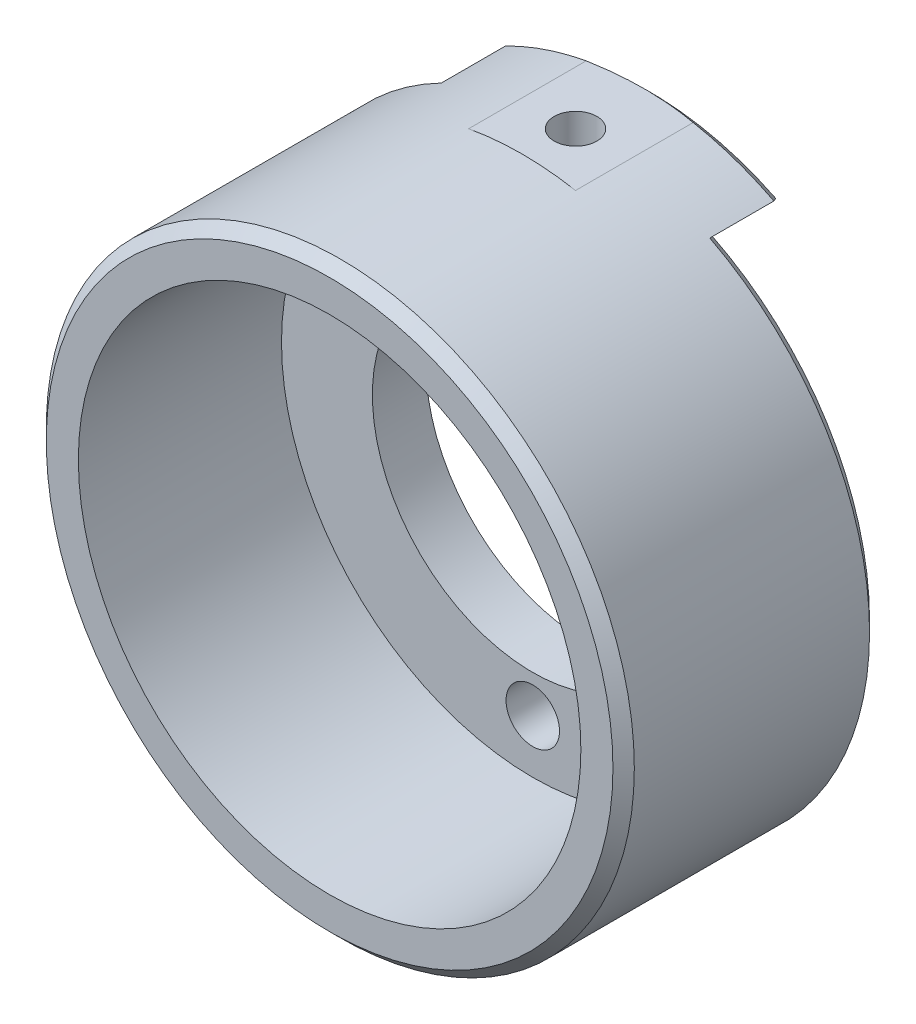
from build123d import *
from build123d.topology import SkipClean

# Parameters (mm, degrees)
SKETCH1_W               = 8.5
SKETCH1_H               = 5
SKETCH2_R               = 3.5
SKETCH2_R_2             = 2.5
BOSS_EXTRUDE1_DEPTH     = 6
CHAMFER1_SIZE           = 1
SKETCH4_W               = 10
SKETCH4_H               = 12
SKETCH4_R               = 2
CUT_EXTRUDE1_DEPTH      = 2.958365434
CUT_EXTRUDE2_DEPTH      = 7.958365434
CUT_EXTRUDE8_DEPTH      = 5
CUT_EXTRUDE8_DEPTH_BACK = 5
SKETCH8_R               = 2
SKETCH2_3_R             = 2.5
CUT_EXTRUDE9_DEPTH      = 46.700109409


with BuildPart() as part:
    # Sketch1 → Revolve1 (revolve)
    with BuildSketch(Plane(origin=(0, 0, 0), x_dir=(1, 0, 0), z_dir=(0, 1, 0)), mode=Mode.PRIVATE) as revolve1_sk:
        with Locations((-19.25, 21.5)):
            Rectangle(SKETCH1_W, SKETCH1_H)
        Polygon((-23.5, 19), (-23.5, 24), (-27.5, 24), (-27.5, 0), (-23.5, 0), align=None)
    revolve(revolve1_sk.sketch.rotate(Axis((0, 0, 8.695652174), (0, 0, -1)), 180), axis=Axis((0, 0, 8.695652174), (0, 0, -1)))

    # Sketch2 → Boss-Extrude1 (add)
    # profile 1 of 4: a face of its own
    with BuildSketch(Plane(origin=(0, 0, -24), x_dir=(-1, 0, 0), z_dir=(0, 0, -1))):
        with BuildLine():
            ThreePointArc((12.555578353, 24.466455653), (0, 27.5), (-12.555578353, 24.466455653))
            Line((-12.555578353, 24.466455653), (-2.249756634, 15.818844449))
            ThreePointArc((-2.249756634, 15.818844449), (-1.479163916, 21.672077255), (3.5, 18.5))
            ThreePointArc((3.5, 18.5), (3.172077255, 17.020836084), (2.249756634, 15.818844449))
            Line((2.249756634, 15.818844449), (12.555578353, 24.466455653))
        make_face()
    # profile 2 of 4: a face of its own
    with BuildSketch(Plane(origin=(0, 0, -24), x_dir=(-1, 0, 0), z_dir=(0, 0, -1))):
        with Locations((0, 18.5)):
            Circle(SKETCH2_R)
        with Locations((0, 18.5)):
            Circle(SKETCH2_R_2, mode=Mode.SUBTRACT)
    # profile 3 of 4: a face of its own
    with BuildSketch(Plane(origin=(0, 0, -24), x_dir=(-1, 0, 0), z_dir=(0, 0, -1))):
        with Locations((0, -18.5)):
            Circle(SKETCH2_R)
        with Locations((0, -18.5)):
            Circle(SKETCH2_R_2, mode=Mode.SUBTRACT)
    # profile 4 of 4: a face of its own
    with BuildSketch(Plane(origin=(0, 0, -24), x_dir=(-1, 0, 0), z_dir=(0, 0, -1))):
        with BuildLine():
            ThreePointArc((3.5, -18.5), (-1.479163916, -21.672077255), (-2.249756634, -15.818844449))
            Line((-2.249756634, -15.818844449), (-12.555578353, -24.466455653))
            ThreePointArc((-12.555578353, -24.466455653), (0, -27.5), (12.555578353, -24.466455653))
            Line((12.555578353, -24.466455653), (2.249756634, -15.818844449))
            ThreePointArc((2.249756634, -15.818844449), (3.172077255, -17.020836084), (3.5, -18.5))
        make_face()
    extrude(amount=BOSS_EXTRUDE1_DEPTH)

    # Chamfer1
    # the kernel refuses this chamfer: 1 mm, written as the material it takes off along each edge
    with BuildSketch(Plane(origin=(0, 0, 0), x_dir=(1, 0, 0), z_dir=(0, 1, 0))) as chamfer1_piece_1:
        Polygon((27.5, CHAMFER1_SIZE), (27.5 - CHAMFER1_SIZE, 0), (27.5, 0), align=None)
    revolve(axis=Axis((0, 0, 0), (0, 0, -1)), mode=Mode.SUBTRACT)
    with BuildSketch(Plane(origin=(0, 0, -24), x_dir=(-0.37142479481354274, -0.9284630427743032, 0), z_dir=(0.9284630427743032, -0.37142479481354274, 0))) as chamfer1_piece_2_section:
        Polygon((27.5 - CHAMFER1_SIZE, 0), (27.5, -CHAMFER1_SIZE), (27.5, 0), align=None)
    chamfer1_piece_2 = revolve(axis=Axis((0, 0, -24), (0, 0, -1)), revolution_arc=136.392970134, mode=Mode.PRIVATE)
    chamfer1_piece_2 = split(chamfer1_piece_2, bisect_by=Plane(origin=(-8.997837151, -21.481156322, -23.522667498), z_dir=(-0.6427876096865377, 0.7660444431189795, 0)), keep=Keep.TOP, mode=Mode.PRIVATE)
    chamfer1_piece_2 = split(chamfer1_piece_2, bisect_by=Plane(origin=(-8.997837151, 21.481156322, -23.522667498), z_dir=(-0.6427876096865377, -0.7660444431189795, 0)), keep=Keep.TOP, mode=Mode.PRIVATE)
    add(chamfer1_piece_2, mode=Mode.SUBTRACT)
    with BuildSketch(Plane(origin=(0, 0, -30), x_dir=(-0.5376618435911517, 0.8431605671200261, 0), z_dir=(-0.8431605671200261, -0.5376618435911517, 0))) as chamfer1_piece_3:
        Polygon((27.5 - CHAMFER1_SIZE, 0), (27.5, -CHAMFER1_SIZE), (27.5, 0), align=None)
    revolve(axis=Axis((0, 0, -30), (0, 0, -1)), revolution_arc=65.049223624, mode=Mode.SUBTRACT)
    with BuildSketch(Plane(origin=(0, 0, -24), x_dir=(1, 0, 0), z_dir=(0, 1, 0))) as chamfer1_piece_4_section:
        Polygon((27.5 - CHAMFER1_SIZE, 0), (27.5, -CHAMFER1_SIZE), (27.5, 0), align=None)
    chamfer1_piece_4 = revolve(axis=Axis((0, 0, -24), (0, 0, -1)), revolution_arc=68.193336432, mode=Mode.PRIVATE)
    chamfer1_piece_4 = split(chamfer1_piece_4, bisect_by=Plane(origin=(13.63014134, -25.368121058, -23.51799123), z_dir=(0.642787609686538, 0.7660444431189791, 0)), keep=Keep.TOP, mode=Mode.PRIVATE)
    add(chamfer1_piece_4, mode=Mode.SUBTRACT)
    with BuildSketch(Plane(origin=(0, 0, -30), x_dir=(0.537661843591152, -0.8431605671200257, 0), z_dir=(0.8431605671200257, 0.537661843591152, 0))) as chamfer1_piece_5:
        Polygon((27.5, -CHAMFER1_SIZE), (27.5 - CHAMFER1_SIZE, 0), (27.5, 0), align=None)
    revolve(axis=Axis((0, 0, -30), (0, 0, -1)), revolution_arc=65.049223624, mode=Mode.SUBTRACT)
    with BuildSketch(Plane(origin=(0, 0, -24), x_dir=(0.37147581705781124, 0.9284426300753492, 0), z_dir=(-0.9284426300753492, 0.37147581705781124, 0))) as chamfer1_piece_6_section:
        Polygon((27.5 - CHAMFER1_SIZE, 0), (27.5, -CHAMFER1_SIZE), (27.5, 0), align=None)
    chamfer1_piece_6 = revolve(axis=Axis((0, 0, -24), (0, 0, -1)), revolution_arc=68.193336432, mode=Mode.PRIVATE)
    chamfer1_piece_6 = split(chamfer1_piece_6, bisect_by=Plane(origin=(13.630141348, 25.368121065, -23.517991241), z_dir=(0.642787609686538, -0.7660444431189791, 0)), keep=Keep.TOP, mode=Mode.PRIVATE)
    add(chamfer1_piece_6, mode=Mode.SUBTRACT)

    # Sketch4 → Cut-Extrude1 (cut)
    with BuildSketch(Plane(origin=(0, 30, 0), x_dir=(1, 0, 0), z_dir=(0, 1, 0))):
        with Locations((0, 24)):
            Rectangle(SKETCH4_W, SKETCH4_H)
        with Locations(Location((0, 23, 0), (0, 0, 270))):
            Circle(SKETCH4_R, mode=Mode.SUBTRACT)
    cut_extrude1 = extrude(amount=-CUT_EXTRUDE1_DEPTH, mode=Mode.SUBTRACT)

    # Sketch4<3> → Cut-Extrude2 (cut)
    with BuildSketch(Plane(origin=(0, 30, 0), x_dir=(1, 0, 0), z_dir=(0, 1, 0))):
        with BuildLine():
            ThreePointArc((2, 23), (1.414213562, 24.414213562), (0, 25))
            Line((0, 25), (0, 21))
            ThreePointArc((0, 21), (1.414213562, 21.585786438), (2, 23))
        make_face()
        with BuildLine():
            Line((0, 21), (0, 25))
            ThreePointArc((0, 25), (-2, 23), (0, 21))
        make_face()
    extrude(amount=-CUT_EXTRUDE2_DEPTH, mode=Mode.SUBTRACT)

    # Mirror2: Cut-Extrude1 across plane
    add(cut_extrude1.mirror(Plane.ZX), mode=Mode.SUBTRACT)

    # Sketch8 → Cut-Extrude8 (cut, two sides: drawn at the far end of the back side and taken through both)
    with BuildSketch(Plane.XZ.offset(27.041634566).offset(-CUT_EXTRUDE8_DEPTH_BACK)):
        with Locations(Location((0, -23, 0), (0, 0, 90))):
            Circle(SKETCH8_R)
    extrude(amount=CUT_EXTRUDE8_DEPTH + CUT_EXTRUDE8_DEPTH_BACK, mode=Mode.SUBTRACT)

    # Sketch2<3> → Cut-Extrude9 (cut, through all)
    with SkipClean():  # the faces are left unmerged after this step: merging them gives an invalid solid
        with BuildSketch(Plane(origin=(0, 0, -24), x_dir=(-1, 0, 0), z_dir=(0, 0, -1))):
            with Locations(Location((0, -18.5, 0), (0, 0, 180))):
                Circle(SKETCH2_3_R)
            with Locations(Location((0, 18.5, 0), (0, 0, 180))):
                Circle(SKETCH2_3_R)
        extrude(amount=-CUT_EXTRUDE9_DEPTH, mode=Mode.SUBTRACT)
    add(part.part.scale(1), mode=Mode.REPLACE)  # the faces are merged on a copy


solid = part.part
